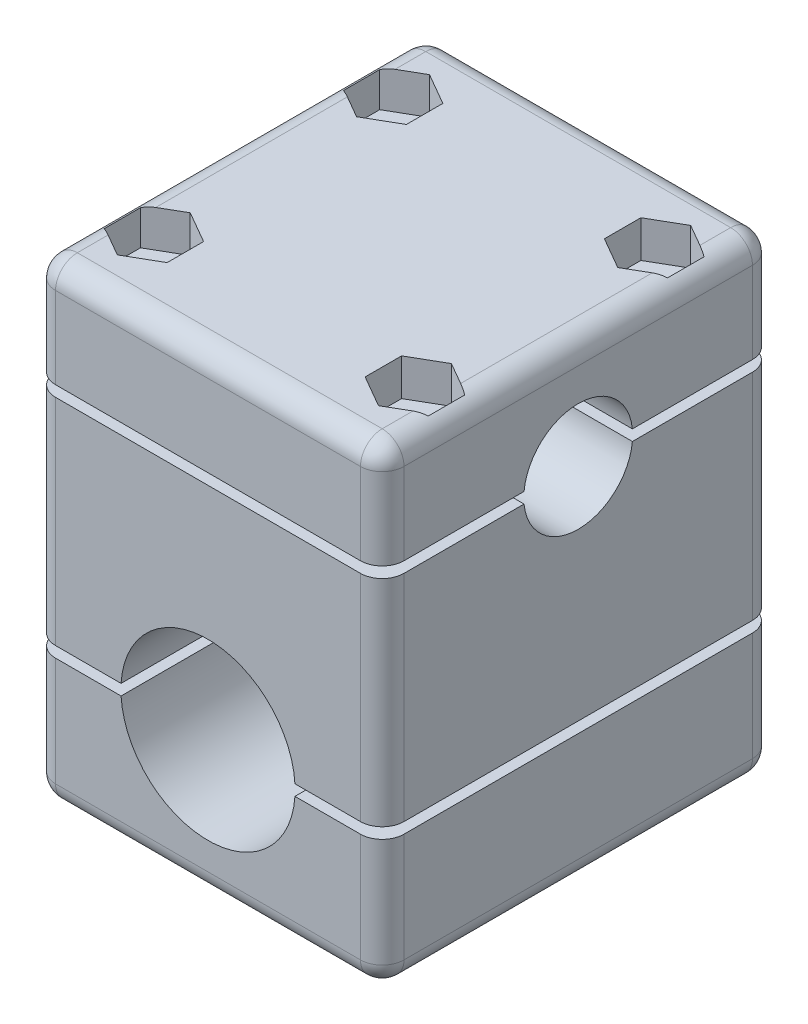
from build123d import *

# Parameters (mm, degrees)
BOSS_EXTRUDE1_DEPTH     = 32
BOSS_EXTRUDE1_2_DEPTH   = 32
CUT_EXTRUDE3_DEPTH      = 53.24816764
BOSS_EXTRUDE2_DEPTH     = 36
CUT_EXTRUDE4_DEPTH      = 49.210652315
CUT_EXTRUDE4_DEPTH_BACK = 49.210652315
SKETCH5_R               = 1.475
CUT_EXTRUDE5_START      = -3.4
SKETCH7_R               = 1.475
CUT_EXTRUDE5_DEPTH      = 3.4
SKETCH8_R               = 2.75
CUT_EXTRUDE6_DEPTH      = 3.5
FILLET1_R               = 2
FILLET2_R               = 2
FILLET3_R               = 2


with BuildPart() as part:
    # Sketch1 → Boss-Extrude1 (new body)
    with BuildSketch(Plane(origin=(0, 0, 0), x_dir=(0, 0, -1), z_dir=(1, 0, 0))):
        with BuildLine():
            Line((-18, 10), (-18, 0.5))
            Line((-18, 0.5), (-4.974937186, 0.5))
            ThreePointArc((-4.974937186, 0.5), (0, 5), (4.974937186, 0.5))
            Line((4.974937186, 0.5), (18, 0.5))
            Line((18, 0.5), (18, 10))
            Line((18, 10), (-18, 10))
        make_face()
    extrude(amount=BOSS_EXTRUDE1_DEPTH)


with BuildPart() as body_2:
    # Sketch1 → Boss-Extrude1 2 (new body)
    with BuildSketch(Plane(origin=(0, 0, 0), x_dir=(0, 0, -1), z_dir=(1, 0, 0))):
        with BuildLine():
            Line((-18, -0.5), (-18, -10))
            Line((-18, -10), (-18, -20.245271588))
            Line((-18, -20.245271588), (18, -20.245271588))
            Line((18, -20.245271588), (18, -10))
            Line((18, -10), (18, -0.5))
            Line((18, -0.5), (4.974937186, -0.5))
            ThreePointArc((4.974937186, -0.5), (0, -5), (-4.974937186, -0.5))
            Line((-4.974937186, -0.5), (-18, -0.5))
        make_face()
    extrude(amount=BOSS_EXTRUDE1_2_DEPTH)

    # Sketch2 → Cut-Extrude3 (cut, through all)
    with BuildSketch(Plane.XY.offset(18)):
        with BuildLine():
            ThreePointArc((23.984359711, -20.245271588), (16, -12.745271588), (8.015640289, -20.245271588))
            Line((8.015640289, -20.245271588), (23.984359711, -20.245271588))
        make_face()
    extrude(amount=-CUT_EXTRUDE3_DEPTH, mode=Mode.SUBTRACT)


with BuildPart() as body_3:
    # Sketch3 → Boss-Extrude2 (new body)
    with BuildSketch(Plane.XY.offset(18)):
        with BuildLine():
            Line((32, -21.245271588), (23.984359711, -21.245271588))
            ThreePointArc((23.984359711, -21.245271588), (16, -28.745271588), (8.015640289, -21.245271588))
            Line((8.015640289, -21.245271588), (0, -21.245271588))
            Line((0, -21.245271588), (0, -33.245271588))
            Line((0, -33.245271588), (32, -33.245271588))
            Line((32, -33.245271588), (32, -21.245271588))
        make_face()
    extrude(amount=-BOSS_EXTRUDE2_DEPTH)


with BuildPart() as cut_extrude4_tool:
    # Sketch5 → Cut-Extrude4 (new, two sides: drawn at the far end of the back side and taken through both)
    with BuildSketch(Plane(origin=(0, -21.245271588, 0), x_dir=(1, 0, 0), z_dir=(0, 1, 0)).offset(-CUT_EXTRUDE4_DEPTH_BACK)):
        with Locations(Location((4.007820144, 10.987468593, 0), (0, 0, 270))):
            Circle(SKETCH5_R)
        with Locations(Location((27.992179856, 10.987468593, 0), (0, 0, 270))):
            Circle(SKETCH5_R)
        with Locations(Location((27.992179856, -10.987468593, 0), (0, 0, 270))):
            Circle(SKETCH5_R)
        with Locations(Location((4.007820144, -10.987468593, 0), (0, 0, 270))):
            Circle(SKETCH5_R)
    extrude(amount=CUT_EXTRUDE4_DEPTH + CUT_EXTRUDE4_DEPTH_BACK)


with BuildPart() as part_1:
    add(part.part)

    # Cut-Extrude4: cut by cut_extrude4_tool
    add(cut_extrude4_tool.part, mode=Mode.SUBTRACT)

    # Sketch7 → Cut-Extrude5 (cut)
    # profile 1 of 4: a face of its own
    with BuildSketch(Plane(origin=(0, 10, 0), x_dir=(1, 0, 0), z_dir=(0, 1, 0)).offset(CUT_EXTRUDE5_START)):
        Polygon((6.907820144, 9.313152812), (6.907820144, 12.661784373), (4.007820144, 14.336100154), (1.107820144, 12.661784373), (1.107820144, 9.313152812), (4.007820144, 7.638837031), align=None)
        with Locations(Location((4.007820144, 10.987468593, 0), (0, 0, 270))):
            Circle(SKETCH7_R, mode=Mode.SUBTRACT)
    # profile 2 of 4: a face of its own
    with BuildSketch(Plane(origin=(0, 10, 0), x_dir=(1, 0, 0), z_dir=(0, 1, 0)).offset(CUT_EXTRUDE5_START)):
        Polygon((27.992179856, 7.638837031), (25.092179856, 9.313152812), (25.092179856, 12.661784373), (27.992179856, 14.336100154), (30.892179856, 12.661784373), (30.892179856, 9.313152812), align=None)
        with Locations(Location((27.992179856, 10.987468593, 0), (0, 0, 270))):
            Circle(SKETCH7_R, mode=Mode.SUBTRACT)
    # profile 3 of 4: a face of its own
    with BuildSketch(Plane(origin=(0, 10, 0), x_dir=(1, 0, 0), z_dir=(0, 1, 0)).offset(CUT_EXTRUDE5_START)):
        Polygon((25.092179856, -9.313152812), (25.092179856, -12.661784373), (27.992179856, -14.336100154), (30.892179856, -12.661784373), (30.892179856, -9.313152812), (27.992179856, -7.638837031), align=None)
        with Locations(Location((27.992179856, -10.987468593, 0), (0, 0, 270))):
            Circle(SKETCH7_R, mode=Mode.SUBTRACT)
    # profile 4 of 4: a face of its own
    with BuildSketch(Plane(origin=(0, 10, 0), x_dir=(1, 0, 0), z_dir=(0, 1, 0)).offset(CUT_EXTRUDE5_START)):
        Polygon((4.007820144, -7.638837031), (6.907820144, -9.313152812), (6.907820144, -12.661784373), (4.007820144, -14.336100154), (1.107820144, -12.661784373), (1.107820144, -9.313152812), align=None)
        with Locations(Location((4.007820144, -10.987468593, 0), (0, 0, 270))):
            Circle(SKETCH7_R, mode=Mode.SUBTRACT)
    extrude(amount=CUT_EXTRUDE5_DEPTH, mode=Mode.SUBTRACT)

    # Fillet1
    # the kernel refuses this fillet: 2 mm, written as the material it takes off along each edge
    with BuildSketch(Plane(origin=(2, 8, 16), x_dir=(0, 1, 0), z_dir=(0, 0, 1))) as fillet1_piece_1_section:
        Polygon((0, 0), (FILLET1_R, 0), (FILLET1_R, FILLET1_R), (0, FILLET1_R), align=None)
    fillet1_piece_1 = extrude(amount=FILLET1_R, mode=Mode.PRIVATE)
    fillet1_piece_1 = fillet1_piece_1 - Plane(origin=(2, 8, 16), x_dir=(0.7071067811865475, -0.7071067811865475, 0), z_dir=(0, 0, 1)) * Sphere(FILLET1_R, mode=Mode.PRIVATE)
    add(fillet1_piece_1, mode=Mode.SUBTRACT)
    with BuildSketch(Plane(origin=(30, 8, 16), x_dir=(0, 1, 0), z_dir=(0, 0, 1))) as fillet1_piece_2_section:
        Polygon((0, 0), (FILLET1_R, 0), (FILLET1_R, -FILLET1_R), (0, -FILLET1_R), align=None)
    fillet1_piece_2 = extrude(amount=FILLET1_R, mode=Mode.PRIVATE)
    fillet1_piece_2 = fillet1_piece_2 - Plane(origin=(30, 8, 16), x_dir=(-0.7071067811865475, -0.7071067811865475, 0), z_dir=(0, 0, 1)) * Sphere(FILLET1_R, mode=Mode.PRIVATE)
    add(fillet1_piece_2, mode=Mode.SUBTRACT)
    with BuildSketch(Plane(origin=(2, 8, -16), x_dir=(-1, 0, 0), z_dir=(0, 1, 0))) as fillet1_piece_3_section:
        Polygon((0, 0), (FILLET1_R, 0), (FILLET1_R, -FILLET1_R), (0, -FILLET1_R), align=None)
    fillet1_piece_3 = extrude(amount=FILLET1_R, mode=Mode.PRIVATE)
    fillet1_piece_3 = fillet1_piece_3 - Plane(origin=(2, 8, -16), x_dir=(0.7071067811865475, 0, 0.7071067811865475), z_dir=(0, 1, 0)) * Sphere(FILLET1_R, mode=Mode.PRIVATE)
    add(fillet1_piece_3, mode=Mode.SUBTRACT)
    with BuildSketch(Plane(origin=(30, 8, -16), x_dir=(1, 0, 0), z_dir=(0, 1, 0))) as fillet1_piece_4_section:
        Polygon((0, 0), (FILLET1_R, 0), (FILLET1_R, FILLET1_R), (0, FILLET1_R), align=None)
    fillet1_piece_4 = extrude(amount=FILLET1_R, mode=Mode.PRIVATE)
    fillet1_piece_4 = fillet1_piece_4 - Plane(origin=(30, 8, -16), x_dir=(-0.7071067811865475, 0, 0.7071067811865475), z_dir=(0, 1, 0)) * Sphere(FILLET1_R, mode=Mode.PRIVATE)
    add(fillet1_piece_4, mode=Mode.SUBTRACT)
    with BuildSketch(Plane(origin=(2, 10, 18), x_dir=(0, -1, 0), z_dir=(1, 0, 0)), Plane(origin=(2, 10, -18), x_dir=(0, 0, 1), z_dir=(1, 0, 0))) as fillet1_piece_5:
        with BuildLine():
            CenterArc((FILLET1_R, FILLET1_R), FILLET1_R, 180, 90)
            Line((0, FILLET1_R), (0, 0))
            Line((0, 0), (FILLET1_R, 0))
        make_face()
    extrude(amount=28, mode=Mode.SUBTRACT)
    with BuildSketch(Plane(origin=(0, 10, -16), x_dir=(1, 0, 0), z_dir=(0, 0, 1))) as fillet1_piece_6:
        with BuildLine():
            CenterArc((FILLET1_R, -FILLET1_R), FILLET1_R, 90, 90)
            Line((0, -FILLET1_R), (0, 0))
            Line((0, 0), (FILLET1_R, 0))
        make_face()
    extrude(amount=32, mode=Mode.SUBTRACT)
    with BuildSketch(Plane(origin=(32, 10, -16), x_dir=(-1, 0, 0), z_dir=(0, 0, 1))) as fillet1_piece_7:
        with BuildLine():
            CenterArc((FILLET1_R, FILLET1_R), FILLET1_R, 180, 90)
            Line((0, FILLET1_R), (0, 0))
            Line((0, 0), (FILLET1_R, 0))
        make_face()
    extrude(amount=32, mode=Mode.SUBTRACT)
    with BuildSketch(Plane(origin=(0, -4.5, -18), x_dir=(0, 0, 1), z_dir=(0, 1, 0)), Plane(origin=(32, 8, 18), x_dir=(-1, 0, 0), z_dir=(0, -1, 0))) as fillet1_piece_8:
        with BuildLine():
            CenterArc((FILLET1_R, FILLET1_R), FILLET1_R, 180, 90)
            Line((0, FILLET1_R), (0, 0))
            Line((0, 0), (FILLET1_R, 0))
        make_face()
    extrude(amount=12.5, mode=Mode.SUBTRACT)
    with BuildSketch(Plane(origin=(0, 8, 18), x_dir=(1, 0, 0), z_dir=(0, -1, 0)), Plane(origin=(32, -4.5, -18), x_dir=(0, 0, 1), z_dir=(0, 1, 0))) as fillet1_piece_9:
        with BuildLine():
            CenterArc((FILLET1_R, -FILLET1_R), FILLET1_R, 90, 90)
            Line((0, -FILLET1_R), (0, 0))
            Line((0, 0), (FILLET1_R, 0))
        make_face()
    extrude(amount=12.5, mode=Mode.SUBTRACT)


with BuildPart() as body_2_1:
    add(body_2.part)

    # Cut-Extrude4: cut by cut_extrude4_tool
    add(cut_extrude4_tool.part, mode=Mode.SUBTRACT)

    # Fillet2
    fillet2_edges = [body_2_1.edges().sort_by_distance(p)[0] for p in [
        (32, -10.372635794, 18),
        (32, -10.372635794, -18),
        (0, -10.372635794, -18),
        (0, -10.372635794, 18),
    ]]
    fillet(fillet2_edges, radius=FILLET2_R)


with BuildPart() as body_3_1:
    add(body_3.part)

    # Cut-Extrude4: cut by cut_extrude4_tool
    add(cut_extrude4_tool.part, mode=Mode.SUBTRACT)

    # Sketch8 → Cut-Extrude6 (cut)
    with BuildSketch(Plane(origin=(0, -33.245271588, 0), x_dir=(-1, 0, 0), z_dir=(0, -1, 0))):
        with Locations(Location((-27.992179856, 10.987468593, 0), (0, 0, 90))):
            Circle(SKETCH8_R)
        with Locations(Location((-4.007820144, 10.987468593, 0), (0, 0, 270))):
            Circle(SKETCH8_R)
        with Locations(Location((-4.007820144, -10.987468593, 0), (0, 0, 90))):
            Circle(SKETCH8_R)
        with Locations(Location((-27.992179856, -10.987468593, 0), (0, 0, 270))):
            Circle(SKETCH8_R)
    extrude(amount=-CUT_EXTRUDE6_DEPTH, mode=Mode.SUBTRACT)

    # Fillet3
    # the kernel refuses this fillet: 2 mm, written as the material it takes off along each edge
    with BuildSketch(Plane(origin=(2, -31.245271588, 16), x_dir=(0, 0, 1), z_dir=(-1, 0, 0))) as fillet3_piece_1_section:
        Polygon((0, 0), (FILLET3_R, 0), (FILLET3_R, -FILLET3_R), (0, -FILLET3_R), align=None)
    fillet3_piece_1 = extrude(amount=FILLET3_R, mode=Mode.PRIVATE)
    fillet3_piece_1 = fillet3_piece_1 - Plane(origin=(2, -31.245271588, 16), x_dir=(0, 0.7071067811865475, -0.7071067811865475), z_dir=(-1, 0, 0)) * Sphere(FILLET3_R, mode=Mode.PRIVATE)
    add(fillet3_piece_1, mode=Mode.SUBTRACT)
    with BuildSketch(Plane(origin=(2, -31.245271588, -16), x_dir=(0, 0, -1), z_dir=(-1, 0, 0))) as fillet3_piece_2_section:
        Polygon((0, 0), (FILLET3_R, 0), (FILLET3_R, FILLET3_R), (0, FILLET3_R), align=None)
    fillet3_piece_2 = extrude(amount=FILLET3_R, mode=Mode.PRIVATE)
    fillet3_piece_2 = fillet3_piece_2 - Plane(origin=(2, -31.245271588, -16), x_dir=(0, 0.7071067811865475, 0.7071067811865475), z_dir=(-1, 0, 0)) * Sphere(FILLET3_R, mode=Mode.PRIVATE)
    add(fillet3_piece_2, mode=Mode.SUBTRACT)
    with BuildSketch(Plane(origin=(30, -31.245271588, 16), x_dir=(0, 0, 1), z_dir=(1, 0, 0))) as fillet3_piece_3_section:
        Polygon((0, 0), (FILLET3_R, 0), (FILLET3_R, FILLET3_R), (0, FILLET3_R), align=None)
    fillet3_piece_3 = extrude(amount=FILLET3_R, mode=Mode.PRIVATE)
    fillet3_piece_3 = fillet3_piece_3 - Plane(origin=(30, -31.245271588, 16), x_dir=(0, 0.7071067811865475, -0.7071067811865475), z_dir=(1, 0, 0)) * Sphere(FILLET3_R, mode=Mode.PRIVATE)
    add(fillet3_piece_3, mode=Mode.SUBTRACT)
    with BuildSketch(Plane(origin=(30, -31.245271588, -16), x_dir=(0, 0, -1), z_dir=(1, 0, 0))) as fillet3_piece_4_section:
        Polygon((0, 0), (FILLET3_R, 0), (FILLET3_R, -FILLET3_R), (0, -FILLET3_R), align=None)
    fillet3_piece_4 = extrude(amount=FILLET3_R, mode=Mode.PRIVATE)
    fillet3_piece_4 = fillet3_piece_4 - Plane(origin=(30, -31.245271588, -16), x_dir=(0, 0.7071067811865475, 0.7071067811865475), z_dir=(1, 0, 0)) * Sphere(FILLET3_R, mode=Mode.PRIVATE)
    add(fillet3_piece_4, mode=Mode.SUBTRACT)
    with BuildSketch(Plane(origin=(0, -33.245271588, 16), x_dir=(1, 0, 0), z_dir=(0, 0, -1)), Plane(origin=(32, -33.245271588, 16), x_dir=(0, 1, 0), z_dir=(0, 0, -1))) as fillet3_piece_5:
        with BuildLine():
            CenterArc((FILLET3_R, -FILLET3_R), FILLET3_R, 90, 90)
            Line((0, -FILLET3_R), (0, 0))
            Line((0, 0), (FILLET3_R, 0))
        make_face()
    extrude(amount=32, mode=Mode.SUBTRACT)
    with BuildSketch(Plane(origin=(2, -33.245271588, -18), x_dir=(0, 1, 0), z_dir=(1, 0, 0))) as fillet3_piece_6:
        with BuildLine():
            CenterArc((FILLET3_R, FILLET3_R), FILLET3_R, 180, 90)
            Line((0, FILLET3_R), (0, 0))
            Line((0, 0), (FILLET3_R, 0))
        make_face()
    extrude(amount=28, mode=Mode.SUBTRACT)
    with BuildSketch(Plane(origin=(32, -31.245271588, -18), x_dir=(0, 0, 1), z_dir=(0, 1, 0)), Plane(origin=(0, -16.245271588, 18), x_dir=(1, 0, 0), z_dir=(0, -1, 0))) as fillet3_piece_7:
        with BuildLine():
            CenterArc((FILLET3_R, -FILLET3_R), FILLET3_R, 90, 90)
            Line((0, -FILLET3_R), (0, 0))
            Line((0, 0), (FILLET3_R, 0))
        make_face()
    extrude(amount=15, mode=Mode.SUBTRACT)
    with BuildSketch(Plane(origin=(0, -16.245271588, -18), x_dir=(1, 0, 0), z_dir=(0, -1, 0)), Plane(origin=(32, -31.245271588, 18), x_dir=(0, 0, -1), z_dir=(0, 1, 0))) as fillet3_piece_8:
        with BuildLine():
            CenterArc((FILLET3_R, FILLET3_R), FILLET3_R, 180, 90)
            Line((0, FILLET3_R), (0, 0))
            Line((0, 0), (FILLET3_R, 0))
        make_face()
    extrude(amount=15, mode=Mode.SUBTRACT)
    with BuildSketch(Plane(origin=(2, -33.245271588, 18), x_dir=(0, 1, 0), z_dir=(1, 0, 0))) as fillet3_piece_9:
        with BuildLine():
            CenterArc((FILLET3_R, -FILLET3_R), FILLET3_R, 90, 90)
            Line((0, -FILLET3_R), (0, 0))
            Line((0, 0), (FILLET3_R, 0))
        make_face()
    extrude(amount=28, mode=Mode.SUBTRACT)


solid = Compound([part_1.part, body_2_1.part, body_3_1.part])
